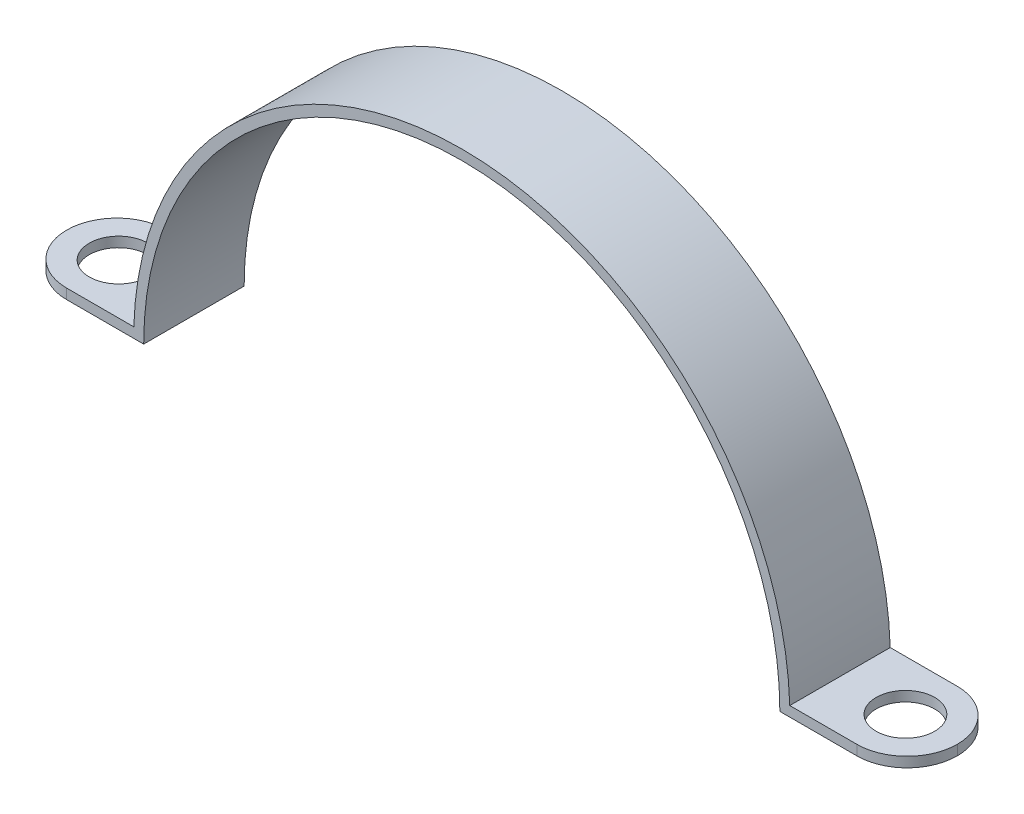
from build123d import *

# Parameters (mm, degrees)
BOSS_EXTRU_1_DEPTH      = 3
CONG_1_R                = 3
ESQUISSE2_R             = 1.75
ENL_V_MAT_EXTRU_1_DEPTH = 33.826209041


with BuildPart() as part:
    # Esquisse1 → Boss.-Extru.1 (new, symmetric)
    with BuildSketch(Plane.XY):
        with BuildLine():
            Line((-26.6, 0), (-19, 0))
            ThreePointArc((-19, 0), (0, 19), (19, 0))
            Line((19, 0), (26.6, 0))
            Line((26.6, 0), (26.6, 0.6))
            Line((26.6, 0.6), (19.590814174, 0.6))
            ThreePointArc((19.590814174, 0.6), (0, 19.6), (-19.590814174, 0.6))
            Line((-19.590814174, 0.6), (-26.6, 0.6))
            Line((-26.6, 0.6), (-26.6, 0))
        make_face()
    extrude(amount=BOSS_EXTRU_1_DEPTH, both=True)

    # Congé1
    cong_1_edges = [part.edges().sort_by_distance(p)[0] for p in [
        (-26.6, 0.3, -3),
        (-26.6, 0.3, 3),
        (26.6, 0.3, -3),
        (26.6, 0.3, 3),
    ]]
    fillet(cong_1_edges, radius=CONG_1_R - 0.0001)  # a hair under: the kernel refuses the full size

    # Esquisse2 → Enlèv. mat.-Extru.1 (cut, through all)
    with BuildSketch(Plane(origin=(0, 0.6, 0), x_dir=(1, 0, 0), z_dir=(0, 1, 0))):
        with Locations(Location((-23.5, 0, 0), (0, 0, 180))):
            Circle(ESQUISSE2_R)
        with Locations(Location((23.5, 0, 0), (0, 0, 180))):
            Circle(ESQUISSE2_R)
    extrude(amount=-ENL_V_MAT_EXTRU_1_DEPTH, mode=Mode.SUBTRACT)


solid = part.part
